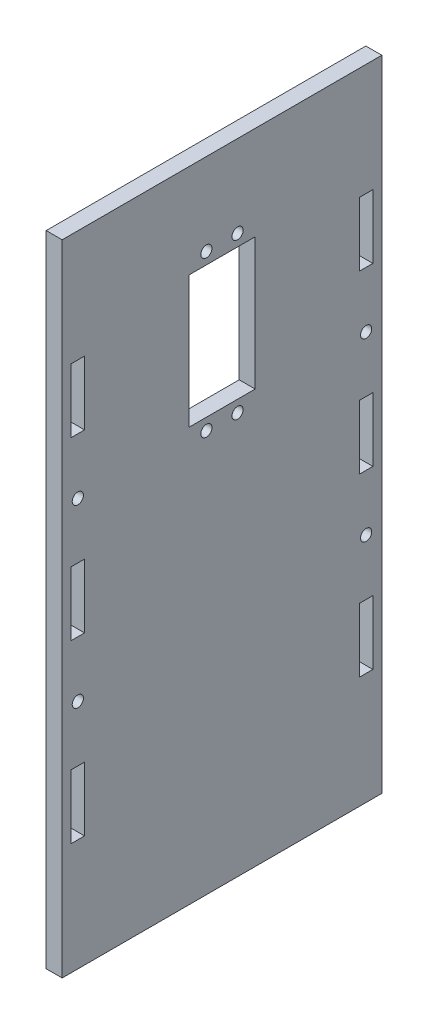
from build123d import *

# Parameters (mm, degrees)
CUT_EXTRUDE1_START     = -5
CUT_EXTRUDE1_OUTLINE_R = 1.75
CUT_EXTRUDE1_OUTLINE_W = 20.75
CUT_EXTRUDE1_OUTLINE_H = 41.25
CUT_EXTRUDE1_DEPTH     = 5
BOSS_EXTRUDE1_START    = -5
BOSS_EXTRUDE1_DEPTH    = 5
SKETCH4_W              = 30
SKETCH4_H              = 60
BOSS_EXTRUDE2_DEPTH    = 5
CUT_EXTRUDE2_REACH     = 160.193
SKETCH5_W              = 4.2
SKETCH5_H              = 20
CUT_EXTRUDE3_REACH     = 160.193
SKETCH6_R              = 1.75


with BuildPart() as part:
    # Cut-Extrude1: read off the stored shape, not the designer's step
    # Cut-Extrude1 outline → Cut-Extrude1 (new body)
    with BuildSketch(Plane(origin=(5, 0, 0), x_dir=(0, 0, -1), z_dir=(1, 0, 0)).offset(CUT_EXTRUDE1_START)):
        with BuildLine():
            Line((-6.17, -30), (6.17, -30))
            ThreePointArc((6.17, -30), (12.413752878, -27.413752878), (15, -21.17))
            Line((15, -21.17), (15, 21.17))
            ThreePointArc((15, 21.17), (12.413752878, 27.413752878), (6.17, 30))
            Line((6.17, 30), (-6.17, 30))
            ThreePointArc((-6.17, 30), (-12.413752878, 27.413752878), (-15, 21.17))
            Line((-15, 21.17), (-15, -21.17))
            ThreePointArc((-15, -21.17), (-12.413752878, -27.413752878), (-6.17, -30))
        make_face()
        with Locations((-4.875, -24.3)):
            Circle(CUT_EXTRUDE1_OUTLINE_R, mode=Mode.SUBTRACT)
        with Locations((4.875, -24.3)):
            Circle(CUT_EXTRUDE1_OUTLINE_R, mode=Mode.SUBTRACT)
        with Locations((-4.875, 24.3)):
            Circle(CUT_EXTRUDE1_OUTLINE_R, mode=Mode.SUBTRACT)
        Rectangle(CUT_EXTRUDE1_OUTLINE_W, CUT_EXTRUDE1_OUTLINE_H, mode=Mode.SUBTRACT)
        with Locations((4.875, 24.3)):
            Circle(CUT_EXTRUDE1_OUTLINE_R, mode=Mode.SUBTRACT)
    extrude(amount=CUT_EXTRUDE1_DEPTH)

    # Sketch2 → Boss-Extrude1 (add)
    with BuildSketch(Plane(origin=(5, 0, 0), x_dir=(0, 0, -1), z_dir=(1, 0, 0)).offset(BOSS_EXTRUDE1_START)):
        with BuildLine():
            Line((10.375, -20.625), (6.17, -20.625))
            Line((6.17, -20.625), (6.17, -21.93080825))
            Line((6.17, -21.93080825), (7.268440243, -21.93080825))
            Line((7.268440243, -21.93080825), (7.268440243, -27.341819789))
            Line((7.268440243, -27.341819789), (6.17, -27.341819789))
            Line((6.17, -27.341819789), (6.17, -30))
            ThreePointArc((6.17, -30), (12.413752878, -27.413752878), (15, -21.17))
            Line((15, -21.17), (15, 21.17))
            ThreePointArc((15, 21.17), (12.413752878, 27.413752878), (6.17, 30))
            Line((6.17, 30), (6.17, 26.982507006))
            Line((6.17, 26.982507006), (7.710578553, 26.982507006))
            Line((7.710578553, 26.982507006), (7.710578553, 21.584637872))
            Line((7.710578553, 21.584637872), (6.17, 21.584637872))
            Line((6.17, 21.584637872), (6.17, 20.625))
            Line((6.17, 20.625), (10.375, 20.625))
            Line((10.375, 20.625), (10.375, -20.625))
        make_face()
        with BuildLine():
            Line((-8.472684232, -21.93080825), (-6.17, -21.93080825))
            Line((-6.17, -21.93080825), (-6.17, -20.625))
            Line((-6.17, -20.625), (-10.375, -20.625))
            Line((-10.375, -20.625), (-10.375, 20.625))
            Line((-10.375, 20.625), (-6.17, 20.625))
            Line((-6.17, 20.625), (-6.17, 21.584637872))
            Line((-6.17, 21.584637872), (-7.710578553, 21.584637872))
            Line((-7.710578553, 21.584637872), (-7.710578553, 26.982507006))
            Line((-7.710578553, 26.982507006), (-6.17, 26.982507006))
            Line((-6.17, 26.982507006), (-6.17, 30))
            ThreePointArc((-6.17, 30), (-12.413752878, 27.413752878), (-15, 21.17))
            Line((-15, 21.17), (-15, -21.17))
            ThreePointArc((-15, -21.17), (-12.413752878, -27.413752878), (-6.17, -30))
            Line((-6.17, -30), (-6.17, -27.341819789))
            Line((-6.17, -27.341819789), (-8.472684232, -27.341819789))
            Line((-8.472684232, -27.341819789), (-8.472684232, -21.93080825))
        make_face()
        with BuildLine():
            Line((-15, 30), (-15, 21.17))
            ThreePointArc((-15, 21.17), (-12.413752878, 27.413752878), (-6.17, 30))
            Line((-6.17, 30), (-15, 30))
        make_face()
        with BuildLine():
            Line((15, 30), (6.17, 30))
            ThreePointArc((6.17, 30), (12.413752878, 27.413752878), (15, 21.17))
            Line((15, 21.17), (15, 30))
        make_face()
        with BuildLine():
            ThreePointArc((15, -21.17), (12.413752878, -27.413752878), (6.17, -30))
            Line((6.17, -30), (15, -30))
            Line((15, -30), (15, -21.17))
        make_face()
        with BuildLine():
            Line((-15, -30), (-6.17, -30))
            ThreePointArc((-6.17, -30), (-12.413752878, -27.413752878), (-15, -21.17))
            Line((-15, -21.17), (-15, -30))
        make_face()
    extrude(amount=BOSS_EXTRUDE1_DEPTH)

    # Sketch4 → Boss-Extrude2 (add)
    with BuildSketch(Plane.ZY):
        Polygon((-50, 50), (50, 50), (50, -50), (50, -150), (-50, -150), (-50, -50), align=None)
        Rectangle(SKETCH4_W, SKETCH4_H, mode=Mode.SUBTRACT)
    extrude(amount=-BOSS_EXTRUDE2_DEPTH)

    # Sketch5 → Cut-Extrude2 (cut, up to next)
    with BuildSketch(Plane(origin=(5, 0, 0), x_dir=(0, 0, -1), z_dir=(1, 0, 0)), mode=Mode.PRIVATE) as cut_extrude2_sk1:
        with Locations((45.1, -105)):
            Rectangle(SKETCH5_W, SKETCH5_H)
    cut_extrude2_tool1 = extrude(cut_extrude2_sk1.sketch, amount=-CUT_EXTRUDE2_REACH, mode=Mode.PRIVATE) & part.part
    # Sketch5 → Cut-Extrude2 (cut, up to next)
    with BuildSketch(Plane(origin=(5, 0, 0), x_dir=(0, 0, -1), z_dir=(1, 0, 0)), mode=Mode.PRIVATE) as cut_extrude2_sk2:
        with Locations((45.1, -50)):
            Rectangle(SKETCH5_W, SKETCH5_H)
    cut_extrude2_tool2 = extrude(cut_extrude2_sk2.sketch, amount=-CUT_EXTRUDE2_REACH, mode=Mode.PRIVATE) & part.part
    # Sketch5 → Cut-Extrude2 (cut, up to next)
    with BuildSketch(Plane(origin=(5, 0, 0), x_dir=(0, 0, -1), z_dir=(1, 0, 0)), mode=Mode.PRIVATE) as cut_extrude2_sk3:
        with Locations((45.1, 5)):
            Rectangle(SKETCH5_W, SKETCH5_H)
    cut_extrude2_tool3 = extrude(cut_extrude2_sk3.sketch, amount=-CUT_EXTRUDE2_REACH, mode=Mode.PRIVATE) & part.part
    # Sketch5 → Cut-Extrude2 (cut, up to next)
    with BuildSketch(Plane(origin=(5, 0, 0), x_dir=(0, 0, -1), z_dir=(1, 0, 0)), mode=Mode.PRIVATE) as cut_extrude2_sk4:
        with Locations((-45.1, 5)):
            Rectangle(SKETCH5_W, SKETCH5_H)
    cut_extrude2_tool4 = extrude(cut_extrude2_sk4.sketch, amount=-CUT_EXTRUDE2_REACH, mode=Mode.PRIVATE) & part.part
    # Sketch5 → Cut-Extrude2 (cut, up to next)
    with BuildSketch(Plane(origin=(5, 0, 0), x_dir=(0, 0, -1), z_dir=(1, 0, 0)), mode=Mode.PRIVATE) as cut_extrude2_sk5:
        with Locations((-45.1, -50)):
            Rectangle(SKETCH5_W, SKETCH5_H)
    cut_extrude2_tool5 = extrude(cut_extrude2_sk5.sketch, amount=-CUT_EXTRUDE2_REACH, mode=Mode.PRIVATE) & part.part
    # Sketch5 → Cut-Extrude2 (cut, up to next)
    with BuildSketch(Plane(origin=(5, 0, 0), x_dir=(0, 0, -1), z_dir=(1, 0, 0)), mode=Mode.PRIVATE) as cut_extrude2_sk6:
        with Locations((-45.1, -105)):
            Rectangle(SKETCH5_W, SKETCH5_H)
    cut_extrude2_tool6 = extrude(cut_extrude2_sk6.sketch, amount=-CUT_EXTRUDE2_REACH, mode=Mode.PRIVATE) & part.part
    add(cut_extrude2_tool1.solids().sort_by_distance((5, -105, -45.1))[0], mode=Mode.SUBTRACT)
    add(cut_extrude2_tool2.solids().sort_by_distance((5, -50, -45.1))[0], mode=Mode.SUBTRACT)
    add(cut_extrude2_tool3.solids().sort_by_distance((5, 5, -45.1))[0], mode=Mode.SUBTRACT)
    add(cut_extrude2_tool4.solids().sort_by_distance((5, 5, 45.1))[0], mode=Mode.SUBTRACT)
    add(cut_extrude2_tool5.solids().sort_by_distance((5, -50, 45.1))[0], mode=Mode.SUBTRACT)
    add(cut_extrude2_tool6.solids().sort_by_distance((5, -105, 45.1))[0], mode=Mode.SUBTRACT)

    # Sketch6 → Cut-Extrude3 (cut, up to next)
    with BuildSketch(Plane.ZY, mode=Mode.PRIVATE) as cut_extrude3_sk1:
        with Locations((45.1, -77.5)):
            Circle(SKETCH6_R)
    cut_extrude3_tool1 = extrude(cut_extrude3_sk1.sketch, amount=-CUT_EXTRUDE3_REACH, mode=Mode.PRIVATE) & part.part
    # Sketch6 → Cut-Extrude3 (cut, up to next)
    with BuildSketch(Plane.ZY, mode=Mode.PRIVATE) as cut_extrude3_sk2:
        with Locations(Location((-45.1, -77.5, 0), (0, 0, 180))):
            Circle(SKETCH6_R)
    cut_extrude3_tool2 = extrude(cut_extrude3_sk2.sketch, amount=-CUT_EXTRUDE3_REACH, mode=Mode.PRIVATE) & part.part
    # Sketch6 → Cut-Extrude3 (cut, up to next)
    with BuildSketch(Plane.ZY, mode=Mode.PRIVATE) as cut_extrude3_sk3:
        with Locations((-45.1, -22.5)):
            Circle(SKETCH6_R)
    cut_extrude3_tool3 = extrude(cut_extrude3_sk3.sketch, amount=-CUT_EXTRUDE3_REACH, mode=Mode.PRIVATE) & part.part
    # Sketch6 → Cut-Extrude3 (cut, up to next)
    with BuildSketch(Plane.ZY, mode=Mode.PRIVATE) as cut_extrude3_sk4:
        with Locations(Location((45.1, -22.5, 0), (0, 0, 180))):
            Circle(SKETCH6_R)
    cut_extrude3_tool4 = extrude(cut_extrude3_sk4.sketch, amount=-CUT_EXTRUDE3_REACH, mode=Mode.PRIVATE) & part.part
    add(cut_extrude3_tool1.solids().sort_by_distance((0, -77.5, 45.1))[0], mode=Mode.SUBTRACT)
    add(cut_extrude3_tool2.solids().sort_by_distance((0, -77.5, -45.1))[0], mode=Mode.SUBTRACT)
    add(cut_extrude3_tool3.solids().sort_by_distance((0, -22.5, -45.1))[0], mode=Mode.SUBTRACT)
    add(cut_extrude3_tool4.solids().sort_by_distance((0, -22.5, 45.1))[0], mode=Mode.SUBTRACT)


solid = part.part
